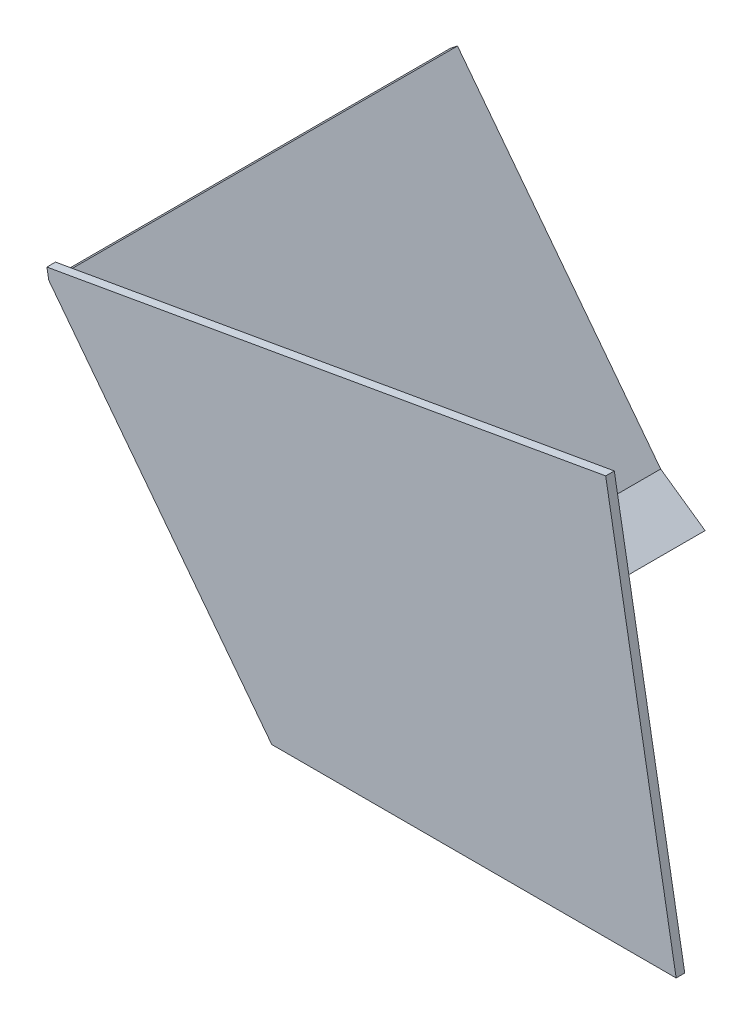
from build123d import *

# Parameters (mm, degrees)
BOSS_EXTRUDE1_DEPTH = 290
BOSS_EXTRUDE2_DEPTH = 6.35


with BuildPart() as part:
    # Sketch1 → Boss-Extrude1 (new body)
    with BuildSketch(Plane.XY):
        Polygon((-162.685454471, 22.943057454), (-312.490020278, 218.17216858), (-317.527813988, 214.306533506), (-153.084627129, 0), (-129.9193727, 0), align=None)
    extrude(amount=BOSS_EXTRUDE1_DEPTH)

    # Sketch2 → Boss-Extrude2 (add)
    with BuildSketch(Plane.XY.offset(290)):
        Polygon((-153.084627129, 0), (-317.527813988, 214.306533506), (-318.884203872, 221.999002792), (93.126310416, 294.647572797), (145.0806273, 0), align=None)
    extrude(amount=BOSS_EXTRUDE2_DEPTH)


solid = part.part
